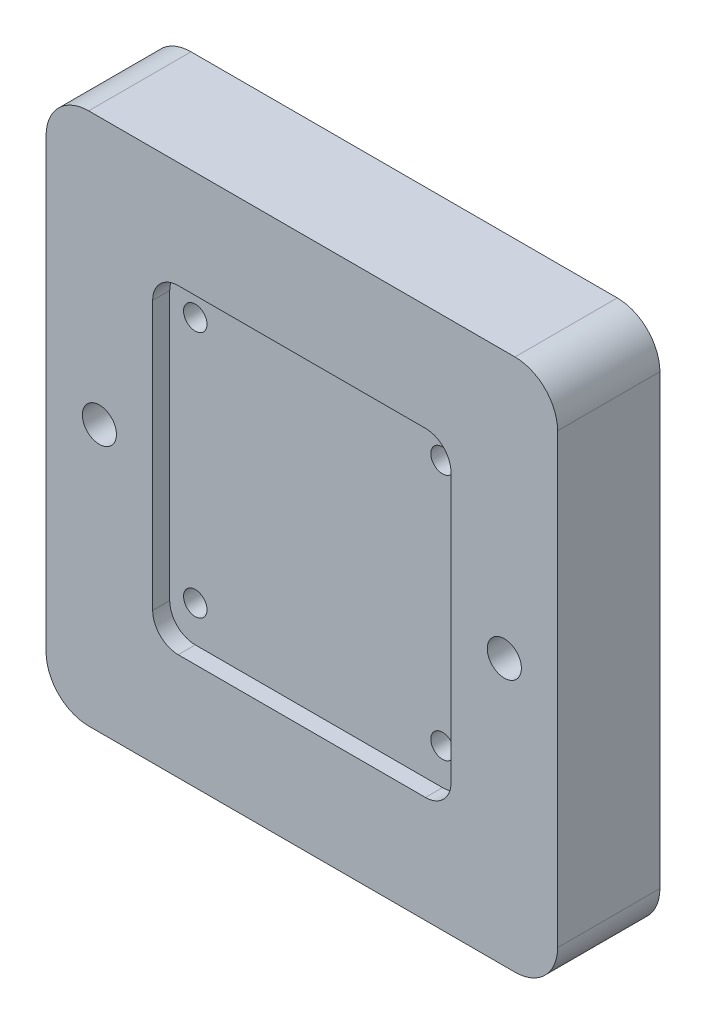
from build123d import *

# Parameters (mm, degrees)
BOSS_EXTRUDE1_DEPTH       = 4
BOSS_EXTRUDE2_DEPTH       = 20
F_8_0MM_DOWEL_HOLE1_D     = 8
F_8_0MM_DOWEL_HOLE1_DEPTH = 18
F_8_0MM_DOWEL_HOLE1_TIP   = 2.403442476
CUT_EXTRUDE1_DEPTH        = 89.917096219
CUT_EXTRUDE1_DEPTH_BACK   = 89.917096219
SKETCH8_R                 = 2.75
CUT_EXTRUDE2_START        = -2.75
CUT_EXTRUDE2_DEPTH        = 93.651334807


with BuildPart() as part:
    # Sketch1 → Boss-Extrude1 (new body)
    with BuildSketch(Plane.XY):
        with BuildLine():
            Line((-50, 62.5), (50, 62.5))
            ThreePointArc((50, 62.5), (57.071067812, 59.571067812), (60, 52.5))
            Line((60, 52.5), (60, -52.5))
            ThreePointArc((60, -52.5), (57.071067812, -59.571067812), (50, -62.5))
            Line((50, -62.5), (-50, -62.5))
            ThreePointArc((-50, -62.5), (-57.071067812, -59.571067812), (-60, -52.5))
            Line((-60, -52.5), (-60, 52.5))
            ThreePointArc((-60, 52.5), (-57.071067812, 59.571067812), (-50, 62.5))
        make_face()
        with BuildLine():
            Line((-29, 37.5), (29, 37.5))
            ThreePointArc((29, 37.5), (33.242640687, 35.742640687), (35, 31.5))
            Line((35, 31.5), (35, -31.5))
            ThreePointArc((35, -31.5), (33.242640687, -35.742640687), (29, -37.5))
            Line((29, -37.5), (-29, -37.5))
            ThreePointArc((-29, -37.5), (-33.242640687, -35.742640687), (-35, -31.5))
            Line((-35, -31.5), (-35, 31.5))
            ThreePointArc((-35, 31.5), (-33.242640687, 35.742640687), (-29, 37.5))
        make_face(mode=Mode.SUBTRACT)
    extrude(amount=-BOSS_EXTRUDE1_DEPTH)

    # Sketch2 → Boss-Extrude2 (add)
    with BuildSketch(Plane.XY.offset(-4)):
        with BuildLine():
            Line((-50, -62.5), (50, -62.5))
            ThreePointArc((50, -62.5), (57.071067812, -59.571067812), (60, -52.5))
            Line((60, -52.5), (60, 52.5))
            ThreePointArc((60, 52.5), (57.071067812, 59.571067812), (50, 62.5))
            Line((50, 62.5), (-50, 62.5))
            ThreePointArc((-50, 62.5), (-57.071067812, 59.571067812), (-60, 52.5))
            Line((-60, 52.5), (-60, -52.5))
            ThreePointArc((-60, -52.5), (-57.071067812, -59.571067812), (-50, -62.5))
        make_face()
    extrude(amount=-BOSS_EXTRUDE2_DEPTH)

    # Ø8.0mm Dowel Hole1
    with Locations(Plane.XY):
        with Locations((-47.5, 0), (47.5, 0)):
            Hole(F_8_0MM_DOWEL_HOLE1_D / 2, depth=F_8_0MM_DOWEL_HOLE1_DEPTH)
            with Locations((0, 0, -(F_8_0MM_DOWEL_HOLE1_DEPTH + F_8_0MM_DOWEL_HOLE1_TIP / 2))):  # 118° drill point
                Cone(0, F_8_0MM_DOWEL_HOLE1_D / 2, F_8_0MM_DOWEL_HOLE1_TIP, mode=Mode.SUBTRACT)

    # Sketch8 → Cut-Extrude1 (cut, two sides: drawn at the far end of the back side and taken through both)
    with BuildSketch(Plane.XY.offset(-4).offset(-CUT_EXTRUDE1_DEPTH_BACK)):
        with Locations((-29, 29)):
            Circle(SKETCH8_R)
        with Locations((29, 29)):
            Circle(SKETCH8_R)
        with Locations((29, -29)):
            Circle(SKETCH8_R)
        with Locations((-29, -29)):
            Circle(SKETCH8_R)
    extrude(amount=CUT_EXTRUDE1_DEPTH + CUT_EXTRUDE1_DEPTH_BACK, mode=Mode.SUBTRACT)

    # Sketch9 → Cut-Extrude2 (cut)
    with BuildSketch(Plane(origin=(0, 0, -24), x_dir=(-1, 0, 0), z_dir=(0, 0, -1)).offset(CUT_EXTRUDE2_START)):
        Polygon((-33.1, 26.632863896), (-29, 24.265727793), (-24.9, 26.632863896), (-24.9, 31.367136104), (-29, 33.734272207), (-33.1, 31.367136104), align=None)
    cut_extrude2 = extrude(amount=CUT_EXTRUDE2_DEPTH, mode=Mode.SUBTRACT)

    # Sketch-Pattern1: Cut-Extrude2 at 3 more places
    with Locations((-58, 0, 0), (0, -58, 0), (-58, -58, 0)):
        add(cut_extrude2, mode=Mode.SUBTRACT)


solid = part.part
